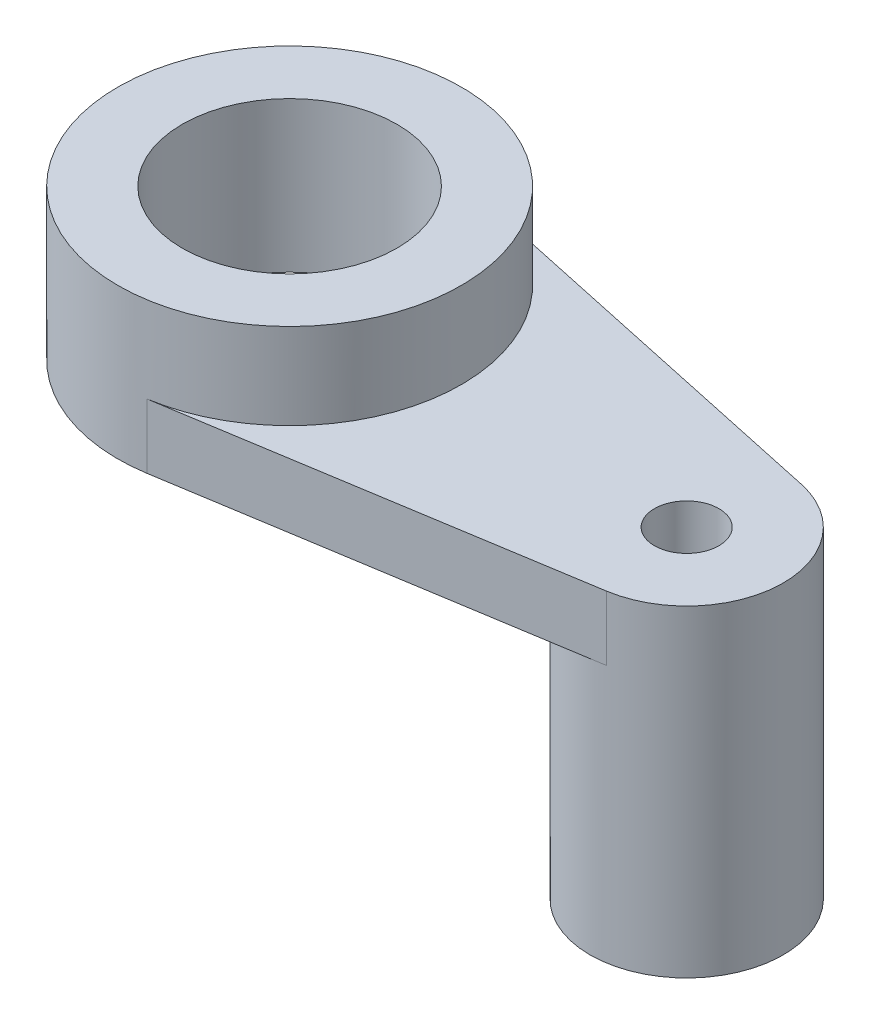
from build123d import *

# Parameters (mm, degrees)
SKETCH1_R           = 3
BOSS_EXTRUDE1_DEPTH = 6
BOSS_EXTRUDE2_START = -24
SKETCH1_3_R         = 3
BOSS_EXTRUDE2_DEPTH = 24
SKETCH1_4_R         = 10
BOSS_EXTRUDE3_DEPTH = 14


with BuildPart() as part:
    # Sketch1 → Boss-Extrude1 (new body)
    with BuildSketch(Plane(origin=(0, 0, 0), x_dir=(1, 0, 0), z_dir=(0, 1, 0))):
        with BuildLine():
            Line((2.528504773, -15.798945016), (39.408869623, -9.896514285))
            ThreePointArc((39.408869623, -9.896514285), (46.983408615, -1.24872533), (39.878920726, 7.789202893))
            Line((39.878920726, 7.789202893), (3.364151178, 15.642329969))
            ThreePointArc((3.364151178, 15.642329969), (15.994351869, -0.425097985), (2.528504773, -15.798945016))
        make_face()
        with Locations((37.986585688, -1.009607714)):
            Circle(SKETCH1_R, mode=Mode.SUBTRACT)
    extrude(amount=BOSS_EXTRUDE1_DEPTH)

    # Sketch1<3> → Boss-Extrude2 (add)
    with BuildSketch(Plane(origin=(0, 0, 0), x_dir=(1, 0, 0), z_dir=(0, 1, 0)).offset(BOSS_EXTRUDE2_START)):
        with BuildLine():
            ThreePointArc((46.986585688, -1.009607714), (44.987693292, 4.645875672), (39.878920726, 7.789202893))
            ThreePointArc((39.878920726, 7.789202893), (28.989762762, -0.770490097), (39.408869623, -9.896514285))
            ThreePointArc((39.408869623, -9.896514285), (44.834963431, -6.849104464), (46.986585688, -1.009607714))
        make_face()
        with Locations((37.986585688, -1.009607714)):
            Circle(SKETCH1_3_R, mode=Mode.SUBTRACT)
    extrude(amount=BOSS_EXTRUDE2_DEPTH)

    # Sketch1<4> → Boss-Extrude3 (add)
    with BuildSketch(Plane(origin=(0, 0, 0), x_dir=(1, 0, 0), z_dir=(0, 1, 0))):
        with BuildLine():
            ThreePointArc((16, 0), (12.446413517, 10.054192686), (3.364151178, 15.642329969))
            ThreePointArc((3.364151178, 15.642329969), (-15.994351869, 0.425097985), (2.528504773, -15.798945016))
            ThreePointArc((2.528504773, -15.798945016), (12.174893765, -10.381327555), (16, 0))
        make_face()
        Circle(SKETCH1_4_R, mode=Mode.SUBTRACT)
    extrude(amount=BOSS_EXTRUDE3_DEPTH)


solid = part.part
